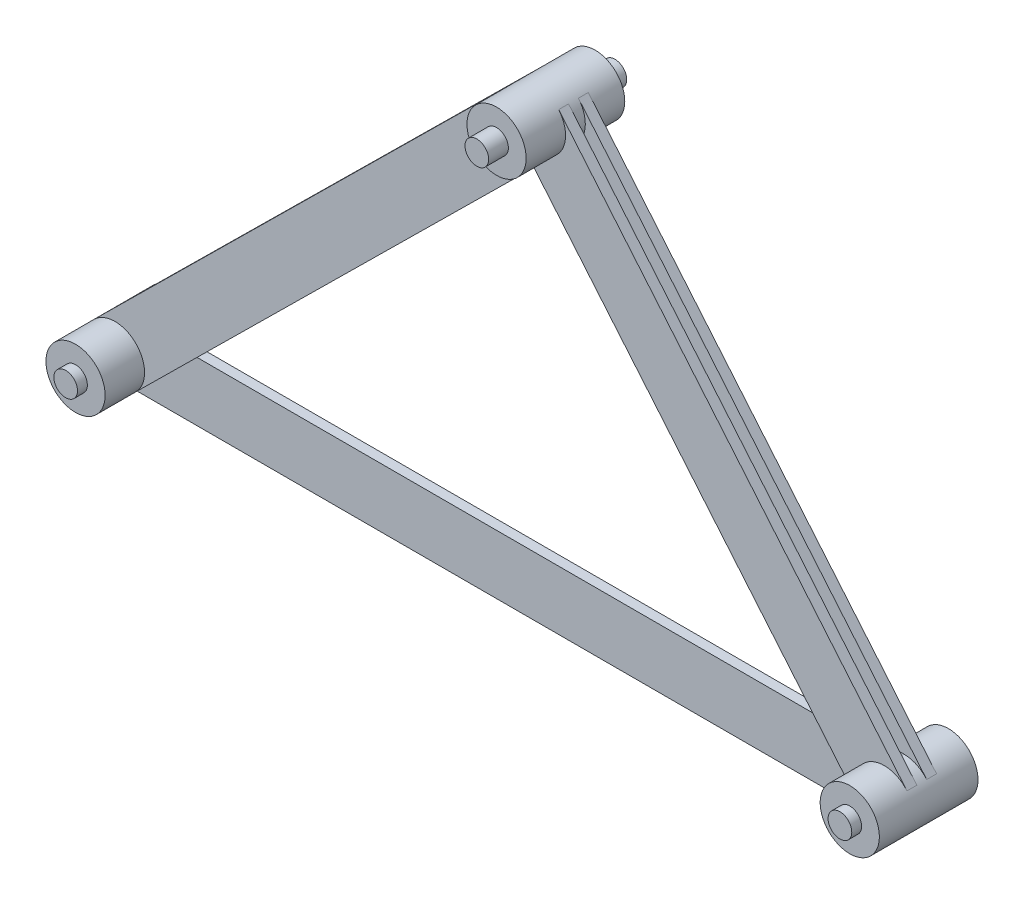
from build123d import *
from build123d.topology import SkipClean

# Parameters (mm, degrees)
EXTRUDE_1_DEPTH = 2.5
SKETCH_3_R      = 15
EXTRUDE_2_DEPTH = 25
SKETCH_4_R      = 6
EXTRUDE_3_DEPTH = 5
EXTRUDE_START   = 5
EXTRUDE_4_DEPTH = 5
EXTRUDE_5_DEPTH = 5
SKETCH_9_R      = 15
EXTRUDE_8_DEPTH = 25
SKETCH_10_R     = 6
EXTRUDE_9_DEPTH = 30
SKETCH_7_R      = 15
EXTRUDE_6_DEPTH = 25
SKETCH_8_R      = 6
EXTRUDE_7_DEPTH = 10


with BuildPart() as part:
    # 草图1 → 凸台-拉伸1 (new, symmetric)
    with BuildSketch(Plane.XY):
        with BuildLine():
            Line((0, 15), (390, 15))
            ThreePointArc((390, 15), (405, 0), (390, -15))
            Line((390, -15), (0, -15))
            ThreePointArc((0, -15), (-15, 0), (0, 15))
        make_face()
    extrude(amount=EXTRUDE_1_DEPTH, both=True)

    # 草图3 → 凸台-拉伸2 (add, symmetric)
    with SkipClean():  # the faces are left unmerged after this step: merging them gives an invalid solid
        with BuildSketch(Plane.XY):
            with Locations((390, 0)):
                Circle(SKETCH_3_R)
        extrude(amount=EXTRUDE_2_DEPTH, both=True)

    # 草图4 → 凸台-拉伸3 (add)
    with SkipClean():  # the faces are left unmerged after this step: merging them gives an invalid solid
        with BuildSketch(Plane.XY.offset(25)):
            with Locations((390, 0)):
                Circle(SKETCH_4_R)
        extrude_3 = extrude(amount=EXTRUDE_3_DEPTH)

    # 草图5 → 凸台-拉伸4 (add)
    with SkipClean():  # the faces are left unmerged after this step: merging them gives an invalid solid
        with BuildSketch(Plane.XY.offset(2.5).offset(EXTRUDE_START)):
            with BuildLine():
                Line((224.929119743, 220.45771588), (401.499632564, 9.631118881))
                ThreePointArc((401.499632564, 9.631118881), (399.631118881, -11.499632564), (378.500367436, -9.631118881))
                Line((378.500367436, -9.631118881), (201.929854616, 201.195478118))
                ThreePointArc((201.929854616, 201.195478118), (203.798368298, 222.326229563), (224.929119743, 220.45771588))
            make_face()
        extrude_4 = extrude(amount=-EXTRUDE_4_DEPTH)
    add(part.part.scale(1), mode=Mode.REPLACE)  # the faces are merged on a copy

    # 草图6 → 凸台-拉伸5 (add)
    with SkipClean():  # the faces are left unmerged after this step: merging them gives an invalid solid
        with BuildSketch(Plane.XY.offset(2.5).offset(EXTRUDE_START)):
            with BuildLine():
                Line((-10.54132985, 10.671474359), (202.88815733, 221.498071358))
                ThreePointArc((202.88815733, 221.498071358), (224.100961538, 221.367926849), (223.970817029, 200.15512264))
                Line((223.970817029, 200.15512264), (10.54132985, -10.671474359))
                ThreePointArc((10.54132985, -10.671474359), (-10.671474359, -10.54132985), (-10.54132985, 10.671474359))
            make_face()
        extrude_5 = extrude(amount=-EXTRUDE_5_DEPTH)

    # 镜向1: 凸台-拉伸3, 凸台-拉伸4, 凸台-拉伸5 across plane
    with SkipClean():  # the faces are left unmerged after this step: merging them gives an invalid solid
        add(extrude_3.mirror(Plane.XY))
        add(extrude_4.mirror(Plane.XY))
        add(extrude_5.mirror(Plane.XY))

    # 草图9 → 凸台-拉伸8 (add, symmetric)
    with SkipClean():  # the faces are left unmerged after this step: merging them gives an invalid solid
        with BuildSketch(Plane.XY.offset(2.5)):
            Circle(SKETCH_9_R)
        extrude(amount=EXTRUDE_8_DEPTH, both=True)
    add(part.part.scale(1), mode=Mode.REPLACE)  # the faces are merged on a copy

    # 草图10 → 凸台-拉伸9 (add, symmetric)
    with BuildSketch(Plane.XY.offset(2.5)):
        Circle(SKETCH_10_R)
    extrude(amount=EXTRUDE_9_DEPTH, both=True)

    # 草图7 → 凸台-拉伸6 (add, symmetric)
    with SkipClean():  # the faces are left unmerged after this step: merging them gives an invalid solid
        with BuildSketch(Plane.XY.offset(2.5)):
            with Locations((213.429487179, 210.826596999)):
                Circle(SKETCH_7_R)
        extrude(amount=EXTRUDE_6_DEPTH, both=True)

    # 草图8 → 凸台-拉伸7 (add)
    with SkipClean():  # the faces are left unmerged after this step: merging them gives an invalid solid
        with BuildSketch(Plane.XY.offset(27.5)):
            with Locations((213.429487179, 210.826596999)):
                Circle(SKETCH_8_R)
        extrude_7 = extrude(amount=EXTRUDE_7_DEPTH)

    # 镜向2: 凸台-拉伸7 across plane
    with SkipClean():  # the faces are left unmerged after this step: merging them gives an invalid solid
        add(extrude_7.mirror(Plane(origin=(213.429487179, 210.826596999, 2.5), x_dir=(1, 0, 0), z_dir=(0, 0, 1))))


solid = part.part
